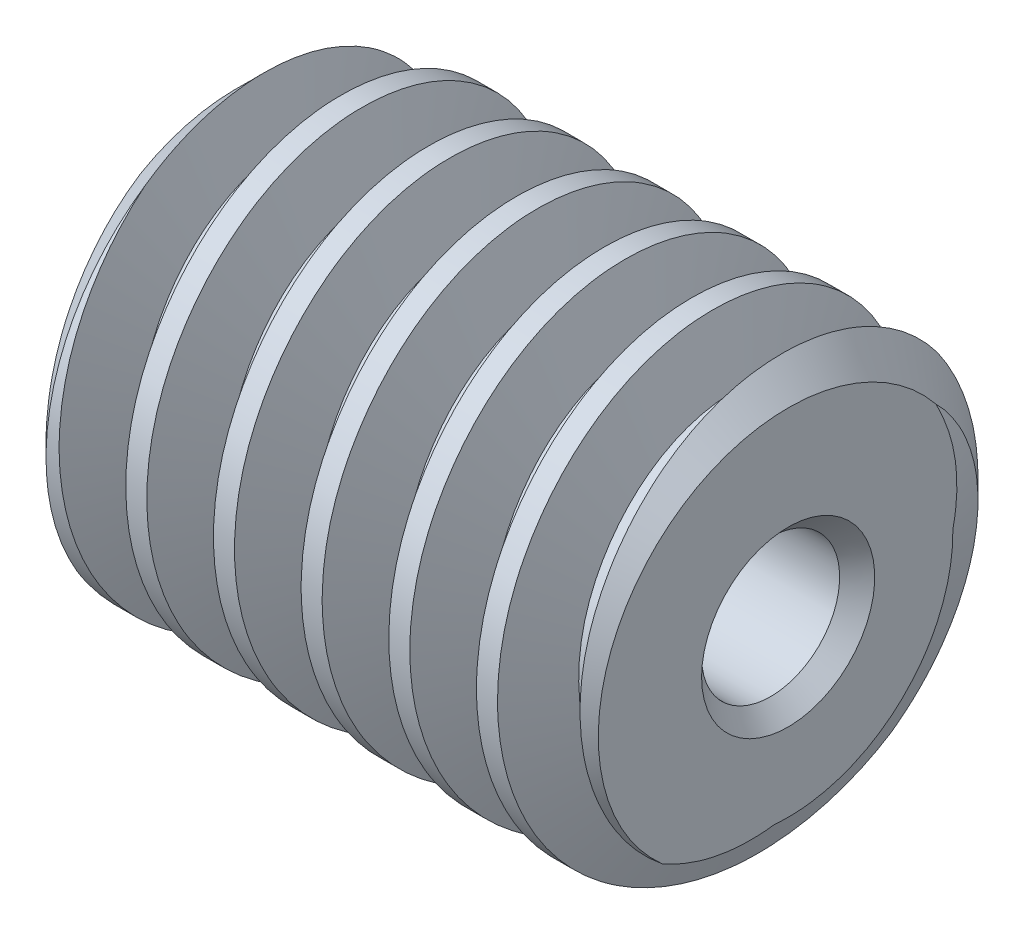
from build123d import *

# Parameters (mm, degrees)
CUT_SWEEP1_PITCH = 0.635


with BuildPart() as part:
    # Sketch1 → Revolve1 (revolve)
    with BuildSketch(Plane.XY, mode=Mode.PRIVATE) as revolve1_sk:
        Polygon((-0.127, 0.5), (-3.873, 0.5), (-4, 0.627), (-4, 1.375), (-3.75, 1.625), (-0.25, 1.625), (0, 1.375), (0, 0.627), align=None)
    revolve(revolve1_sk.sketch.rotate(Axis((-53.110333861, 0, 0), (1, 0, 0)), 90), axis=Axis((-53.110333861, 0, 0), (1, 0, 0)))

    # Cut-Sweep1: the profile of Sketch4 profile screwed along a right-hand helix of 7 turns, 6 arcs to a turn; built about Z, then put on its axis
    cut_sweep1_z = Axis((0, 0, 0), (0, 0, 1))
    cut_sweep1_corners = [(1.6253, 0, 0.000109191), (1.1932, 0, -0.157162347), (1.1932, 0, -0.325437653), (1.6253, 0, -0.482709191)]
    with BuildLine(mode=Mode.PRIVATE) as cut_sweep1_profile:
        Line(cut_sweep1_corners[0], cut_sweep1_corners[1])
        Line(cut_sweep1_corners[1], cut_sweep1_corners[2])
        Line(cut_sweep1_corners[2], cut_sweep1_corners[3])
        Line(cut_sweep1_corners[3], cut_sweep1_corners[0])
    cut_sweep1_cap = Face(cut_sweep1_profile.wire())
    cut_sweep1_turn_angles = [0, 30, 60, 90, 120, 150, 180, 210, 240, 270, 300, 330, 360]
    cut_sweep1_turn_weights = [1, 0.8660254037844387, 1, 0.8660254037844387, 1, 0.8660254037844387, 1, 0.8660254037844387, 1, 0.8660254037844387, 1, 0.8660254037844387, 1]
    cut_sweep1_turn_rails = [Edge.make_bspline([Vector(p[0], p[1], 0).rotate(cut_sweep1_z, cut_sweep1_turn_angles[k]) / cut_sweep1_turn_weights[k] + Vector(0, 0, p[2] + CUT_SWEEP1_PITCH * cut_sweep1_turn_angles[k] / 360) for k in range(13)], [0, 0, 0, 1, 1, 2, 2, 3, 3, 4, 4, 5, 5, 6, 6, 6], 2, cut_sweep1_turn_weights) for p in cut_sweep1_corners]
    cut_sweep1_turn_sides = [Face.make_surface_from_curves(cut_sweep1_turn_rails[p[0]], cut_sweep1_turn_rails[p[1]]) for p in [(0, 1), (1, 2), (2, 3), (3, 0)]]
    cut_sweep1 = Plane(origin=(0, 0, 0), x_dir=(0, 1, 0), z_dir=(-1, 0, 0)) * Solid(Shell([*[p.moved(Location((0, 0, CUT_SWEEP1_PITCH * i))) for i in range(7) for p in cut_sweep1_turn_sides], cut_sweep1_cap, cut_sweep1_cap.rotate(cut_sweep1_z, 2520).moved(Location((0, 0, CUT_SWEEP1_PITCH * 2520 / 360)))]))
    add(cut_sweep1, mode=Mode.SUBTRACT)


solid = part.part
